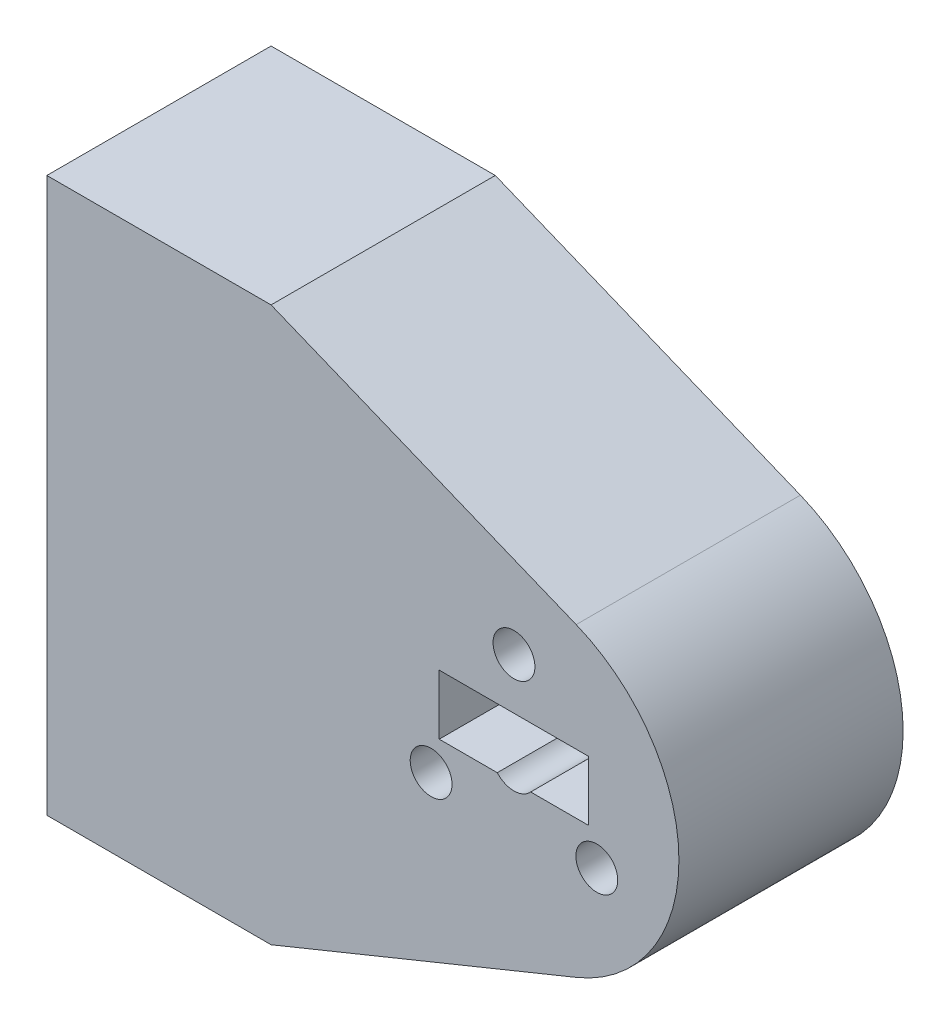
from build123d import *

# Parameters (mm, degrees)
SKETCH_1_R          = 22.07163906423819
SKETCH_1_R_2        = 2.8
SKETCH_1_R_3        = 2.8000000000000003
EXTRUDE_1_DEPTH     = 5
SKETCH_2_R          = 22.07163906423819
SKETCH_2_R_2        = 2.8000000000000003
SKETCH_2_R_3        = 2.8
EXTRUDE_2_DEPTH     = 30
SKETCH_3_R          = 4.999999999999998
SKETCH_3_R_2        = 2.8000000000000003
SKETCH_3_R_3        = 5.000000000000001
SKETCH_3_R_4        = 2.8
SKETCH_3_R_5        = 5
CUT_EXTRUDE_1_DEPTH = 10
FILLET_2_R          = 2
FILLET_3_R          = 2


with BuildPart() as part:
    # 스케치1 → 보스-돌출1 (new body)
    with BuildSketch(Plane.XY):
        Circle(SKETCH_1_R)
        with Locations((0, 12.8)):
            Circle(SKETCH_1_R_2, mode=Mode.SUBTRACT)
        with Locations((-11.085125168440811, -6.400000000000006)):
            Circle(SKETCH_1_R_3, mode=Mode.SUBTRACT)
        with Locations((11.085125168440817, -6.399999999999997)):
            Circle(SKETCH_1_R_3, mode=Mode.SUBTRACT)
        with BuildLine():
            Line((-9.999999999999998, 5.9999999999999964), (10.000000000000002, 6.0000000000000036))
            Line((10.000000000000002, 6.0000000000000036), (10.000000000000004, -1.9999999999999964))
            Line((10.000000000000004, -1.9999999999999973), (2.236067977499654, -1.9999999999999998))
            ThreePointArc((2.236067977499691, -2.00000000000011), (-3.785e-14, -3), (-2.2360679774997423, -2.000000000000053))
            Line((-2.236067977499724, -2.0000000000000013), (-9.999999999999996, -2.0000000000000036))
            Line((-9.999999999999996, -2.0000000000000036), (-9.999999999999996, 5.9999999999999964))
        make_face(mode=Mode.SUBTRACT)
    extrude(amount=EXTRUDE_1_DEPTH)

    # 스케치2 → 보스-돌출2 (add)
    # profile 1 of 4: a face of its own
    with BuildSketch(Plane.XY):
        with BuildLine():
            ThreePointArc((8.32662123293451, -20.440759032512698), (4.242416494011306, -21.660082023698482), (-4.05e-15, -22.07163906423819))
            Line((0, -22.07163906423819), (-62.49999999999999, -22.07163906423819))
            Line((-62.49999999999999, -22.07163906423819), (-62.499999999999986, -37.07163906423819))
            Line((-62.499999999999986, -37.07163906423819), (-32.5, -37.07163906423819))
            Line((-32.5, -37.07163906423819), (8.326621232934514, -20.440759032512695))
        make_face()
    # profile 2 of 4: a face of its own
    with BuildSketch(Plane.XY):
        with BuildLine():
            ThreePointArc((-4.05e-15, -22.07163906423819), (-22.07163906423819, 2.7e-15), (1.35e-15, 22.07163906423819))
            Line((0, 22.07163906423819), (-62.49999999999999, 22.07163906423819))
            Line((-62.49999999999999, 22.07163906423819), (-62.49999999999999, -22.07163906423819))
            Line((-62.49999999999999, -22.07163906423819), (0, -22.07163906423819))
        make_face()
    # profile 3 of 4: a face of its own
    with BuildSketch(Plane.XY):
        Circle(SKETCH_2_R)
        with Locations((11.085125168440817, -6.399999999999997)):
            Circle(SKETCH_2_R_2, mode=Mode.SUBTRACT)
        with Locations((-11.085125168440811, -6.400000000000006)):
            Circle(SKETCH_2_R_2, mode=Mode.SUBTRACT)
        with Locations((0, 12.8)):
            Circle(SKETCH_2_R_3, mode=Mode.SUBTRACT)
        with BuildLine():
            ThreePointArc((-2.23606797749979, -2.0000000000000013), (8.5e-16, -3.000000000000001), (2.2360679774997907, -1.9999999999999996))
            Line((2.2360679774997907, -1.9999999999999996), (10.000000000000004, -1.9999999999999973))
            Line((10.000000000000004, -1.9999999999999973), (10.000000000000002, 6.0000000000000036))
            Line((10.000000000000002, 6.0000000000000036), (-9.999999999999996, 5.9999999999999964))
            Line((-9.999999999999996, 5.9999999999999964), (-9.999999999999996, -2.0000000000000036))
            Line((-9.999999999999996, -2.0000000000000036), (-2.23606797749979, -2.0000000000000013))
        make_face(mode=Mode.SUBTRACT)
    # profile 4 of 4: a face of its own
    with BuildSketch(Plane.XY):
        with BuildLine():
            Line((-62.49999999999999, 22.07163906423819), (0, 22.07163906423819))
            ThreePointArc((1.35e-15, 22.07163906423819), (4.242416494011311, 21.660082023698482), (8.326621232934516, 20.440759032512698))
            Line((8.326621232934514, 20.440759032512695), (-32.500000000000014, 37.07163906423818))
            Line((-32.500000000000014, 37.07163906423818), (-62.5, 37.07163906423818))
            Line((-62.5, 37.07163906423818), (-62.49999999999999, 22.07163906423819))
        make_face()
    extrude(amount=EXTRUDE_2_DEPTH)

    # 스케치3 → 컷-돌출1 (cut)
    # profile 1 of 3: a face of its own
    with BuildSketch(Plane.XY):
        with Locations((11.085125168440817, -6.399999999999997)):
            Circle(SKETCH_3_R)
        with Locations((11.085125168440817, -6.399999999999997)):
            Circle(SKETCH_3_R_2, mode=Mode.SUBTRACT)
    # profile 2 of 3: a face of its own
    with BuildSketch(Plane.XY):
        with Locations((0, 12.8)):
            Circle(SKETCH_3_R_3)
        with Locations((0, 12.8)):
            Circle(SKETCH_3_R_4, mode=Mode.SUBTRACT)
    # profile 3 of 3: a face of its own
    with BuildSketch(Plane.XY):
        with Locations((-11.085125168440811, -6.400000000000006)):
            Circle(SKETCH_3_R_5)
        with Locations((-11.085125168440811, -6.400000000000006)):
            Circle(SKETCH_3_R_2, mode=Mode.SUBTRACT)
    extrude(amount=CUT_EXTRUDE_1_DEPTH, mode=Mode.SUBTRACT)

    # 필렛2
    # the kernel refuses this fillet: 2 mm, written as the material it takes off along each edge
    with BuildSketch(Plane(origin=(10.000000000000004, -1.9999999999999971, 10), x_dir=(0, -1.1e-16, 1), z_dir=(-1, -3.1e-16, 0))) as fillet_2_piece_1_section:
        with BuildLine():
            CenterArc((FILLET_2_R, -FILLET_2_R), FILLET_2_R, 90, 90)
            Line((2.2e-16, -FILLET_2_R), (-FILLET_2_R * 0.02, -FILLET_2_R))
            Line((-FILLET_2_R * 0.02, -FILLET_2_R), (-FILLET_2_R * 0.02, FILLET_2_R * 0.02))
            Line((-FILLET_2_R * 0.02, FILLET_2_R * 0.02), (FILLET_2_R, FILLET_2_R * 0.02))
            Line((FILLET_2_R, FILLET_2_R * 0.02), (FILLET_2_R, 0))
        make_face()
    fillet_2_piece_1 = extrude(amount=6.289743248966767, mode=Mode.PRIVATE)
    fillet_2_piece_1 = fillet_2_piece_1 & Plane(origin=(11.085125168440817, -6.399999999999997, 10.38158038345629), x_dir=(1, 0, 0), z_dir=(0, 0, -1)) * Cylinder(4.999999999999998, 21, mode=Mode.PRIVATE)
    add(fillet_2_piece_1, mode=Mode.SUBTRACT)
    with BuildSketch(Plane(origin=(10.000000000000002, 3.4808301925816174, 10), x_dir=(1, 2.2e-16, 0), z_dir=(2.2e-16, -1, 0))) as fillet_2_piece_2_section:
        with BuildLine():
            CenterArc((FILLET_2_R, FILLET_2_R), FILLET_2_R, 180, 90)
            Line((0, FILLET_2_R), (-FILLET_2_R * 0.02, FILLET_2_R))
            Line((-FILLET_2_R * 0.02, FILLET_2_R), (-FILLET_2_R * 0.02, -FILLET_2_R * 0.02))
            Line((-FILLET_2_R * 0.02, -FILLET_2_R * 0.02), (FILLET_2_R, -FILLET_2_R * 0.02))
            Line((FILLET_2_R, -FILLET_2_R * 0.02), (FILLET_2_R, 0))
        make_face()
    fillet_2_piece_2 = extrude(amount=5.480830192581614, mode=Mode.PRIVATE)
    fillet_2_piece_2 = fillet_2_piece_2 & Plane(origin=(11.085125168440817, -6.399999999999997, 10.432374541535312), x_dir=(1, 0, 0), z_dir=(0, 0, -1)) * Cylinder(4.999999999999998, 19, mode=Mode.PRIVATE)
    add(fillet_2_piece_2, mode=Mode.SUBTRACT)
    with BuildSketch(Plane(origin=(10.000000000000004, -1.5191698074183817, 10), x_dir=(0.9990388643678791, 0.04383317787405267, 0), z_dir=(0, 0, -1))) as fillet_2_piece_3:
        with BuildLine():
            CenterArc((2.088335803131926, -1.9694814149172293), FILLET_2_R, 100.02209773137437, 82.49016328956924)
            Line((0.09025807439617, -2.057147770665381), (0.05029651982145572, -2.058901097780344))
            Line((0.05029651982145572, -2.058901097780344), (-0.03996155457471431, -0.00175332711496207))
            Line((-0.03996155457471431, -0.00175332711496207), (0.0069611193437724, 0.03938962829834457))
            ThreePointArc((0.0069611193437724, 0.03938962829834457), (0.8701399179716347, -0.03629646270692696), (1.733318716599498, 0.0393896282983446))
            Line((1.733318716599498, 0.0393896282983446), (1.7402798359432718, 0))
        make_face()
    extrude(amount=10, mode=Mode.SUBTRACT)
    with BuildSketch(Plane(origin=(8.710256751033235, -1.9999999999999971, 10), x_dir=(-1, -4.8e-16, 0), z_dir=(0, 0, -1))) as fillet_2_piece_4:
        with BuildLine():
            CenterArc((4.200844471701857, -1.9999999999999998), FILLET_2_R, 90, 110.05104256650594)
            Line((2.3220693605277325, -2.685714285714287), (2.28449385830425, -2.699428571428572))
            ThreePointArc((2.28449385830425, -2.699428571428572), (1.377184031846625, -1.1559743499710886), (-0.01899894733926109, -0.0351999999999999))
            Line((-0.01899894733926109, -0.0351999999999999), (-2e-17, 0.04000000000000004))
            Line((-2e-17, 0.04000000000000004), (4.200844471701857, 0.04000000000000004))
            Line((4.200844471701857, 0.04000000000000004), (4.200844471701857, 0))
        make_face()
    extrude(amount=10, mode=Mode.SUBTRACT)
    with BuildSketch(Plane(origin=(15.000000000000004, -1.9999999999999958, 10), x_dir=(0, 1.1e-16, 1), z_dir=(-1, -3.1e-16, 0))) as fillet_2_piece_5a_section:
        with BuildLine():
            CenterArc((FILLET_2_R, -FILLET_2_R), FILLET_2_R, 90, 90)
            Line((-2.2e-16, -FILLET_2_R), (-FILLET_2_R * 0.02, -FILLET_2_R))
            Line((-FILLET_2_R * 0.02, -FILLET_2_R), (-FILLET_2_R * 0.02, FILLET_2_R * 0.02))
            Line((-FILLET_2_R * 0.02, FILLET_2_R * 0.02), (FILLET_2_R, FILLET_2_R * 0.02))
            Line((FILLET_2_R, FILLET_2_R * 0.02), (FILLET_2_R, 0))
        make_face()
    fillet_2_piece_5a = extrude(amount=11.289743248966767, mode=Mode.PRIVATE)
    fillet_2_piece_5a = split(fillet_2_piece_5a, bisect_by=Plane(origin=(10.000000000000004, -2.502531092165931, 10.420578352743194), z_dir=(1, 2.2e-16, 0)), keep=Keep.TOP, mode=Mode.PRIVATE)
    fillet_2_piece_5a = fillet_2_piece_5a & Plane(origin=(11.085125168440817, -6.399999999999997, 10.420578352743194), x_dir=(1, 0, 0), z_dir=(0, 0, -1)) * Cylinder(4.999999999999998, 31, mode=Mode.PRIVATE)
    with BuildSketch(Plane(origin=(10.000000000000002, 3.4808301925816174, 10), x_dir=(1, 2.2e-16, 0), z_dir=(2.2e-16, -1, 0))) as fillet_2_piece_5b_section:
        with BuildLine():
            CenterArc((FILLET_2_R, FILLET_2_R), FILLET_2_R, 180, 90)
            Line((0, FILLET_2_R), (-FILLET_2_R * 0.02, FILLET_2_R))
            Line((-FILLET_2_R * 0.02, FILLET_2_R), (-FILLET_2_R * 0.02, -FILLET_2_R * 0.02))
            Line((-FILLET_2_R * 0.02, -FILLET_2_R * 0.02), (FILLET_2_R, -FILLET_2_R * 0.02))
            Line((FILLET_2_R, -FILLET_2_R * 0.02), (FILLET_2_R, 0))
        make_face()
    fillet_2_piece_5b = extrude(amount=10.480830192581614, mode=Mode.PRIVATE)
    fillet_2_piece_5b = split(fillet_2_piece_5b, bisect_by=Plane(origin=(10.452790228533653, -1.9999999999999971, 10.452790228533651), z_dir=(3.1e-16, -1, 0)), keep=Keep.TOP, mode=Mode.PRIVATE)
    fillet_2_piece_5 = fillet_2_piece_5a & fillet_2_piece_5b
    add(fillet_2_piece_5, mode=Mode.SUBTRACT)
    with BuildSketch(Plane(origin=(10.000000000000004, -1.9999999999999971, 10), x_dir=(0, -1.1e-16, 1), z_dir=(-1, -3.1e-16, 0))) as fillet_2_piece_6a_section:
        with BuildLine():
            CenterArc((FILLET_2_R, -FILLET_2_R), FILLET_2_R, 90, 90)
            Line((2.2e-16, -FILLET_2_R), (-FILLET_2_R * 0.02, -FILLET_2_R))
            Line((-FILLET_2_R * 0.02, -FILLET_2_R), (-FILLET_2_R * 0.02, FILLET_2_R * 0.02))
            Line((-FILLET_2_R * 0.02, FILLET_2_R * 0.02), (FILLET_2_R, FILLET_2_R * 0.02))
            Line((FILLET_2_R, FILLET_2_R * 0.02), (FILLET_2_R, 0))
        make_face()
    fillet_2_piece_6a = extrude(amount=6.289743248966767, mode=Mode.PRIVATE)
    fillet_2_piece_6a = fillet_2_piece_6a - Plane(origin=(11.085125168440817, -6.399999999999997, 10.483868108207538), x_dir=(1, 0, 0), z_dir=(0, 0, -1)) * Cylinder(4.999999999999998, 21, mode=Mode.PRIVATE)
    with BuildSketch(Plane(origin=(8.710256751033235, -1.9999999999999978, 20.50211117925464), x_dir=(-1, -3.2e-16, 0), z_dir=(0, 0, -1))) as fillet_2_piece_6b_section:
        with BuildLine():
            CenterArc((4.200844471701857, -2), FILLET_2_R, 90, 110.05104256650594)
            Line((2.322069360527732, -2.6857142857142864), (2.2844938583042493, -2.6994285714285717))
            ThreePointArc((2.2844938583042493, -2.6994285714285717), (1.377184031846625, -1.1559743499710882), (-0.0189989473392611, -0.03520000000000013))
            Line((-0.0189989473392611, -0.03520000000000013), (-1e-17, 0.04000000000000004))
            Line((-1e-17, 0.04000000000000004), (4.200844471701857, 0.04000000000000004))
            Line((4.200844471701857, 0.04000000000000004), (4.200844471701857, 0))
        make_face()
    fillet_2_piece_6b = extrude(amount=20.50211117925464, mode=Mode.PRIVATE)
    fillet_2_piece_6b = split(fillet_2_piece_6b, bisect_by=Plane(origin=(6.847484840256227, -2.622929884274402, 10), z_dir=(0, 0, 1)), keep=Keep.TOP, mode=Mode.PRIVATE)
    fillet_2_piece_6 = fillet_2_piece_6a & fillet_2_piece_6b
    add(fillet_2_piece_6, mode=Mode.SUBTRACT)
    with BuildSketch(Plane(origin=(10.000000000000004, -1.5191698074183826, 15.147817177180084), x_dir=(0.9990388643678791, 0.043833177874053185, 0), z_dir=(0, 0, -1))) as fillet_2_piece_7a_section:
        with BuildLine():
            CenterArc((2.0883358031319275, -1.969481414917229), FILLET_2_R, 100.02209773137442, 82.49016328956924)
            Line((0.09025807439617109, -2.057147770665382), (0.05029651982145682, -2.058901097780345))
            Line((0.05029651982145682, -2.058901097780345), (-0.03996155457471431, -0.00175332711496209))
            Line((-0.03996155457471431, -0.00175332711496209), (0.00696111934377238, 0.03938962829834458))
            ThreePointArc((0.00696111934377238, 0.03938962829834458), (0.8701399179716348, -0.03629646270692741), (1.7333187165994983, 0.0393896282983446))
            Line((1.7333187165994983, 0.0393896282983446), (1.7402798359432718, 0))
        make_face()
    fillet_2_piece_7a = extrude(amount=15.147817177180084, mode=Mode.PRIVATE)
    fillet_2_piece_7a = split(fillet_2_piece_7a, bisect_by=Plane(origin=(10.391792532024441, -0.9771675464374212, 10), z_dir=(0, 0, 1)), keep=Keep.TOP, mode=Mode.PRIVATE)
    with BuildSketch(Plane(origin=(10.000000000000002, 3.4808301925816174, 10), x_dir=(1, 2.2e-16, 0), z_dir=(2.2e-16, -1, 0))) as fillet_2_piece_7b_section:
        with BuildLine():
            CenterArc((FILLET_2_R, FILLET_2_R), FILLET_2_R, 180, 90)
            Line((0, FILLET_2_R), (-FILLET_2_R * 0.02, FILLET_2_R))
            Line((-FILLET_2_R * 0.02, FILLET_2_R), (-FILLET_2_R * 0.02, -FILLET_2_R * 0.02))
            Line((-FILLET_2_R * 0.02, -FILLET_2_R * 0.02), (FILLET_2_R, -FILLET_2_R * 0.02))
            Line((FILLET_2_R, -FILLET_2_R * 0.02), (FILLET_2_R, 0))
        make_face()
    fillet_2_piece_7b = extrude(amount=5.480830192581614, mode=Mode.PRIVATE)
    fillet_2_piece_7b = fillet_2_piece_7b - Plane(origin=(11.085125168440817, -6.399999999999997, 10.455025581015375), x_dir=(1, 0, 0), z_dir=(0, 0, -1)) * Cylinder(4.999999999999998, 19, mode=Mode.PRIVATE)
    fillet_2_piece_7 = fillet_2_piece_7a & fillet_2_piece_7b
    add(fillet_2_piece_7, mode=Mode.SUBTRACT)

    # 필렛3
    # the kernel refuses this fillet: 2 mm, written as the material it takes off along each edge
    with BuildSketch(Plane(origin=(-3.7102567510332314, -2.0000000000000018, 10), x_dir=(2.9e-16, -1, 0), z_dir=(-1, -2.9e-16, 0))) as fillet_3_piece_1_section:
        with BuildLine():
            CenterArc((FILLET_3_R, FILLET_3_R), FILLET_3_R, 180, 90)
            Line((0, FILLET_3_R), (-FILLET_3_R * 0.02, FILLET_3_R))
            Line((-FILLET_3_R * 0.02, FILLET_3_R), (-FILLET_3_R * 0.02, -FILLET_3_R * 0.02))
            Line((-FILLET_3_R * 0.02, -FILLET_3_R * 0.02), (FILLET_3_R, -FILLET_3_R * 0.02))
            Line((FILLET_3_R, -FILLET_3_R * 0.02), (FILLET_3_R, 0))
        make_face()
    fillet_3_piece_1 = extrude(amount=6.289743248966765, mode=Mode.PRIVATE)
    fillet_3_piece_1 = fillet_3_piece_1 & Plane(origin=(-11.085125168440811, -6.400000000000006, 10.381589776763924), x_dir=(1, 0, 0), z_dir=(0, 0, -1)) * Cylinder(5, 21, mode=Mode.PRIVATE)
    add(fillet_3_piece_1, mode=Mode.SUBTRACT)
    with BuildSketch(Plane(origin=(-9.999999999999996, -1.5191698074183897, 10), x_dir=(0, 1, 0), z_dir=(0, 0, -1))) as fillet_3_piece_2:
        with BuildLine():
            CenterArc((2.05912687087204, -2), FILLET_3_R, 90, 82.49016328956796)
            Line((0.07628199559958171, -1.7386071909830925), (0.0366250980941325, -1.7333793348027537))
            ThreePointArc((0.0366250980941325, -1.7333793348027537), (0.07440257468306455, -0.8677126061855152), (-0.03904664154065296, -0.00868100134752581))
            Line((-0.03904664154065296, -0.00868100134752581), (0, 0.03999999999999915))
            Line((0, 0.03999999999999915), (2.05912687087204, 0.03999999999999915))
            Line((2.05912687087204, 0.03999999999999915), (2.05912687087204, 0))
        make_face()
    extrude(amount=10, mode=Mode.SUBTRACT)
    with BuildSketch(Plane(origin=(-8.710256751033231, -2.0000000000000036, 10), x_dir=(0.6540374294413133, -0.7564621873496382, 0), z_dir=(0, 0, -1))) as fillet_3_piece_3:
        with BuildLine():
            CenterArc((4.260433894453909, -1.8697051388965966), FILLET_3_R, 110.79566042858305, 110.05104256650594)
            Line((2.747509519754633, -3.1777799977792234), (2.7172510322606476, -3.203941494956876))
            Line((2.7172510322606476, -3.203941494956876), (-0.03025848749398555, -0.02616149717765255))
            Line((-0.03025848749398555, -0.02616149717765255), (0.01420144631484614, 0.03739410277793235))
            ThreePointArc((0.01420144631484614, 0.03739410277793235), (1.775180789355795, -0.28573715275850864), (3.5361601323967444, 0.03739410277793173))
            Line((3.5361601323967444, 0.03739410277793173), (3.550361578711591, 3e-17))
        make_face()
    extrude(amount=10, mode=Mode.SUBTRACT)
    with BuildSketch(Plane(origin=(-9.999999999999996, -2.0000000000000036, 10), x_dir=(0, 0, 1), z_dir=(0, 1, 0))) as fillet_3_piece_4_section:
        with BuildLine():
            CenterArc((FILLET_3_R, -FILLET_3_R), FILLET_3_R, 90, 90)
            Line((0, -FILLET_3_R), (-FILLET_3_R * 0.02, -FILLET_3_R))
            Line((-FILLET_3_R * 0.02, -FILLET_3_R), (-FILLET_3_R * 0.02, FILLET_3_R * 0.02))
            Line((-FILLET_3_R * 0.02, FILLET_3_R * 0.02), (FILLET_3_R, FILLET_3_R * 0.02))
            Line((FILLET_3_R, FILLET_3_R * 0.02), (FILLET_3_R, 0))
        make_face()
    fillet_3_piece_4 = extrude(amount=5.480830192581614, mode=Mode.PRIVATE)
    fillet_3_piece_4 = fillet_3_piece_4 & Plane(origin=(-11.085125168440811, -6.400000000000006, 10.43237487449388), x_dir=(1, 0, 0), z_dir=(0, 0, -1)) * Cylinder(5, 19, mode=Mode.PRIVATE)
    add(fillet_3_piece_4, mode=Mode.SUBTRACT)
    with BuildSketch(Plane(origin=(-8.710256751033231, -2.0000000000000036, 20.50211117925464), x_dir=(0.6540374294413133, -0.7564621873496382, 0), z_dir=(0, 0, -1))) as fillet_3_piece_5a_section:
        with BuildLine():
            CenterArc((4.260433894453909, -1.8697051388965966), FILLET_3_R, 110.79566042858305, 110.05104256650594)
            Line((2.747509519754633, -3.1777799977792234), (2.7172510322606476, -3.203941494956876))
            Line((2.7172510322606476, -3.203941494956876), (-0.03025848749398555, -0.02616149717765255))
            Line((-0.03025848749398555, -0.02616149717765255), (0.01420144631484614, 0.03739410277793235))
            ThreePointArc((0.01420144631484614, 0.03739410277793235), (1.775180789355795, -0.28573715275850864), (3.5361601323967444, 0.03739410277793173))
            Line((3.5361601323967444, 0.03739410277793173), (3.550361578711591, 3e-17))
        make_face()
    fillet_3_piece_5a = extrude(amount=20.50211117925464, mode=Mode.PRIVATE)
    fillet_3_piece_5a = split(fillet_3_piece_5a, bisect_by=Plane(origin=(-6.847484840256223, -2.622929884274406, 10), z_dir=(0, 0, 1)), keep=Keep.TOP, mode=Mode.PRIVATE)
    with BuildSketch(Plane(origin=(-3.7102567510332314, -2.0000000000000018, 10), x_dir=(2.9e-16, -1, 0), z_dir=(-1, -2.9e-16, 0))) as fillet_3_piece_5b_section:
        with BuildLine():
            CenterArc((FILLET_3_R, FILLET_3_R), FILLET_3_R, 180, 90)
            Line((0, FILLET_3_R), (-FILLET_3_R * 0.02, FILLET_3_R))
            Line((-FILLET_3_R * 0.02, FILLET_3_R), (-FILLET_3_R * 0.02, -FILLET_3_R * 0.02))
            Line((-FILLET_3_R * 0.02, -FILLET_3_R * 0.02), (FILLET_3_R, -FILLET_3_R * 0.02))
            Line((FILLET_3_R, -FILLET_3_R * 0.02), (FILLET_3_R, 0))
        make_face()
    fillet_3_piece_5b = extrude(amount=6.289743248966765, mode=Mode.PRIVATE)
    fillet_3_piece_5b = fillet_3_piece_5b - Plane(origin=(-11.085125168440811, -6.400000000000006, 10.483871552130461), x_dir=(1, 0, 0), z_dir=(0, 0, -1)) * Cylinder(5, 21, mode=Mode.PRIVATE)
    fillet_3_piece_5 = fillet_3_piece_5a & fillet_3_piece_5b
    add(fillet_3_piece_5, mode=Mode.SUBTRACT)
    with BuildSketch(Plane(origin=(-9.999999999999996, -7.0000000000000036, 10), x_dir=(0, 0, 1), z_dir=(0, 1, 0))) as fillet_3_piece_6a_section:
        with BuildLine():
            CenterArc((FILLET_3_R, -FILLET_3_R), FILLET_3_R, 90, 90)
            Line((0, -FILLET_3_R), (-FILLET_3_R * 0.02, -FILLET_3_R))
            Line((-FILLET_3_R * 0.02, -FILLET_3_R), (-FILLET_3_R * 0.02, FILLET_3_R * 0.02))
            Line((-FILLET_3_R * 0.02, FILLET_3_R * 0.02), (FILLET_3_R, FILLET_3_R * 0.02))
            Line((FILLET_3_R, FILLET_3_R * 0.02), (FILLET_3_R, 0))
        make_face()
    fillet_3_piece_6a = extrude(amount=10.480830192581614, mode=Mode.PRIVATE)
    fillet_3_piece_6a = split(fillet_3_piece_6a, bisect_by=Plane(origin=(-10.45279022853365, -2.0000000000000036, 10.452790228533653), z_dir=(2.9e-16, -1, 0)), keep=Keep.TOP, mode=Mode.PRIVATE)
    with BuildSketch(Plane(origin=(-3.7102567510332314, -2.0000000000000018, 10), x_dir=(2.9e-16, -1, 0), z_dir=(-1, -2.9e-16, 0))) as fillet_3_piece_6b_section:
        with BuildLine():
            CenterArc((FILLET_3_R, FILLET_3_R), FILLET_3_R, 180, 90)
            Line((0, FILLET_3_R), (-FILLET_3_R * 0.02, FILLET_3_R))
            Line((-FILLET_3_R * 0.02, FILLET_3_R), (-FILLET_3_R * 0.02, -FILLET_3_R * 0.02))
            Line((-FILLET_3_R * 0.02, -FILLET_3_R * 0.02), (FILLET_3_R, -FILLET_3_R * 0.02))
            Line((FILLET_3_R, -FILLET_3_R * 0.02), (FILLET_3_R, 0))
        make_face()
    fillet_3_piece_6b = extrude(amount=11.289743248966765, mode=Mode.PRIVATE)
    fillet_3_piece_6b = split(fillet_3_piece_6b, bisect_by=Plane(origin=(-9.999999999999996, -2.5025307306861846, 10.420575876656605), z_dir=(-1, 0, 0)), keep=Keep.TOP, mode=Mode.PRIVATE)
    fillet_3_piece_6b = fillet_3_piece_6b & Plane(origin=(-11.085125168440811, -6.400000000000006, 10.420575876656605), x_dir=(1, 0, 0), z_dir=(0, 0, -1)) * Cylinder(5, 31, mode=Mode.PRIVATE)
    fillet_3_piece_6 = fillet_3_piece_6a & fillet_3_piece_6b
    add(fillet_3_piece_6, mode=Mode.SUBTRACT)
    with BuildSketch(Plane(origin=(-9.999999999999996, -2.0000000000000036, 10), x_dir=(0, 0, 1), z_dir=(0, 1, 0))) as fillet_3_piece_7a_section:
        with BuildLine():
            CenterArc((FILLET_3_R, -FILLET_3_R), FILLET_3_R, 90, 90)
            Line((0, -FILLET_3_R), (-FILLET_3_R * 0.02, -FILLET_3_R))
            Line((-FILLET_3_R * 0.02, -FILLET_3_R), (-FILLET_3_R * 0.02, FILLET_3_R * 0.02))
            Line((-FILLET_3_R * 0.02, FILLET_3_R * 0.02), (FILLET_3_R, FILLET_3_R * 0.02))
            Line((FILLET_3_R, FILLET_3_R * 0.02), (FILLET_3_R, 0))
        make_face()
    fillet_3_piece_7a = extrude(amount=5.480830192581614, mode=Mode.PRIVATE)
    fillet_3_piece_7a = fillet_3_piece_7a - Plane(origin=(-11.085125168440811, -6.400000000000006, 10.455025772702653), x_dir=(1, 0, 0), z_dir=(0, 0, -1)) * Cylinder(5, 19, mode=Mode.PRIVATE)
    with BuildSketch(Plane(origin=(-9.999999999999996, -1.5191698074183897, 15.1478171771801), x_dir=(0, 1, 0), z_dir=(0, 0, -1))) as fillet_3_piece_7b_section:
        with BuildLine():
            CenterArc((2.05912687087204, -2), FILLET_3_R, 90, 82.49016328956796)
            Line((0.07628199559958171, -1.7386071909830925), (0.0366250980941325, -1.7333793348027537))
            ThreePointArc((0.0366250980941325, -1.7333793348027537), (0.07440257468306455, -0.8677126061855152), (-0.03904664154065296, -0.00868100134752581))
            Line((-0.03904664154065296, -0.00868100134752581), (0, 0.03999999999999915))
            Line((0, 0.03999999999999915), (2.05912687087204, 0.03999999999999915))
            Line((2.05912687087204, 0.03999999999999915), (2.05912687087204, 0))
        make_face()
    fillet_3_piece_7b = extrude(amount=15.1478171771801, mode=Mode.PRIVATE)
    fillet_3_piece_7b = split(fillet_3_piece_7b, bisect_by=Plane(origin=(-10.39179253202446, -0.9771675464374194, 10), z_dir=(0, 0, 1)), keep=Keep.TOP, mode=Mode.PRIVATE)
    fillet_3_piece_7 = fillet_3_piece_7a & fillet_3_piece_7b
    add(fillet_3_piece_7, mode=Mode.SUBTRACT)


solid = part.part
